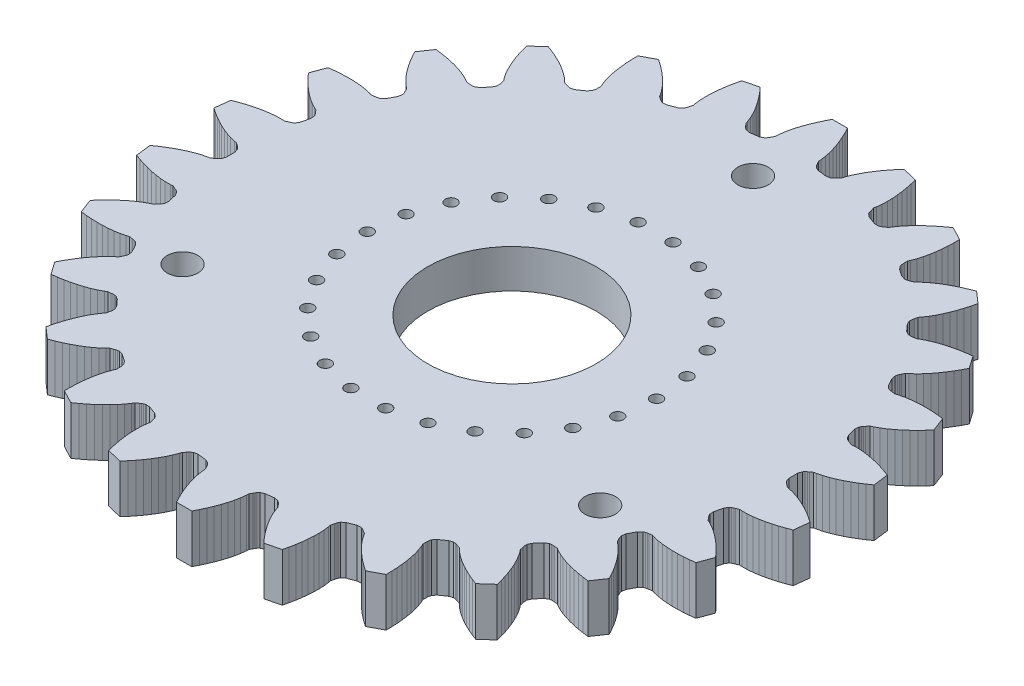
from build123d import *

# Parameters (mm, degrees)
EXTRUDE_RATCHET_EDGE_DEPTH      = 10
PATTERN_EDGE_TO_FORM_GEAR_COUNT = 26
BOSS_EXTRUDE1_DEPTH             = 5
CUT_EXTRUDE1_DEPTH              = 1
SKETCH7_R                       = 8.73125
CUT_BEARING_HOLE_DEPTH          = 51.540175005
CUT_EXTRUDE2_DEPTH              = 1
PIN_HOLES_R                     = 0.6
PIN_HOLES_CUT_DEPTH             = 51.252455557
SKETCH13_R                      = 1.5875
CUT_EXTRUDE3_DEPTH              = 51.252455557
SKETCH14_R                      = 49.986777468
CUT_EXTRUDE4_DEPTH              = 50.288023794


with BuildPart() as part:
    # Sketch1 → Extrude ratchet edge (new body)
    with BuildSketch(Plane(origin=(0, 0, 0), x_dir=(1, 0, 0), z_dir=(0, 1, 0))):
        with BuildLine():
            Line((0, 0), (29.613725431, 7.299127761))
            ThreePointArc((29.613725431, 7.299127761), (31.486736206, 3.871832194), (32, 0))
            Line((32, 0), (0, 0))
        make_face()
    extrude_ratchet_edge = extrude(amount=EXTRUDE_RATCHET_EDGE_DEPTH)

    # Pattern edge to form gear: Extrude ratchet edge ×26 about axis
    pattern_edge_to_form_gear_axis = Axis((0, 10, 0), (0, -1, 0))
    for i in range(1, PATTERN_EDGE_TO_FORM_GEAR_COUNT):
        add(extrude_ratchet_edge.rotate(pattern_edge_to_form_gear_axis, i * 360 / PATTERN_EDGE_TO_FORM_GEAR_COUNT))

    # Sketch12 → Boss-Extrude1 (add)
    with BuildSketch(Plane.XZ):
        Polygon((29.000322753, -0.616570725), (29.119587194, -1.000264746), (29.243967752, -1.150641256), (29.369415025, -1.259655253), (29.495529063, -1.346043346), (29.746268189, -1.535119797), (30.003897471, -1.579567436), (30.516640797, -1.712184271), (31.026553539, -1.886135894), (31.533608527, -2.093643068), (32.037579583, -2.330772238), (32.538146653, -2.595046761), (33.034971107, -2.88478205), (33.527666394, -3.198716608), (34.015860093, -3.535858565), (33.816447683, -5.104204368), (33.259423516, -5.308446667), (32.70383632, -5.489091421), (32.150321721, -5.64527418), (31.599542211, -5.775878742), (31.052267075, -5.879342703), (30.509417131, -5.953364719), (29.972196294, -5.994166602), (29.442574568, -5.994244969), (29.182025762, -5.972811667), (28.891944574, -6.093118219), (28.748223432, -6.14520138), (28.599490608, -6.219357083), (28.441444822, -6.333825435), (28.229944358, -6.675452702), (28.011930996, -7.539016124), (28.035905017, -7.940101093), (28.120680504, -8.11587518), (28.216392404, -8.251742207), (28.318171308, -8.365801825), (28.516371494, -8.609392662), (28.755875004, -8.714201654), (29.221984208, -8.965662), (29.675451563, -9.256588057), (30.118114109, -9.579423324), (30.550688568, -9.930264942), (30.973466667, -10.306654274), (31.38651869, -10.706875291), (31.789774507, -11.129589828), (32.183089813, -11.57376402), (31.614148649, -13.048821615), (31.024422442, -13.113824584), (30.441754669, -13.156257212), (29.866940695, -13.175436936), (29.300913124, -13.170433674), (28.74478387, -13.139917408), (28.199989292, -13.081870202), (27.668616724, -12.992938215), (27.154372567, -12.866268078), (26.906519987, -12.783095695), (26.596074859, -12.830488087), (26.444073202, -12.84666541), (26.281906356, -12.883072461), (26.101055542, -12.956387938), (25.813953244, -13.237478936), (25.395601274, -14.023771373), (25.322903049, -14.418937666), (25.36315151, -14.609882908), (25.423567498, -14.764713169), (25.495086212, -14.899815322), (25.629240235, -15.18375337), (25.836700176, -15.34283377), (26.229084437, -15.698545455), (26.5997556, -16.089541872), (26.952297616, -16.508926), (27.288334305, -16.95309792), (27.60874497, -17.419728423), (27.914013523, -17.907159909), (28.204392535, -18.414097386), (28.479987881, -18.939503891), (27.57456612, -20.235536172), (26.986427049, -20.157520075), (26.410536073, -20.059275238), (25.847829895, -19.940331997), (25.299444988, -19.800019952), (24.766779121, -19.637304534), (24.251710057, -19.450565246), (23.757057144, -19.237040752), (23.288067034, -18.990988592), (23.06732386, -18.850919437), (22.754565163, -18.822639205), (22.603105727, -18.80196765), (22.436947, -18.798508986), (22.243802823, -18.826415616), (21.897766118, -19.030625641), (21.303407339, -19.69395104), (21.138250905, -20.060236642), (21.131629113, -20.255270487), (21.15323291, -20.420055664), (21.190345242, -20.568356596), (21.252649168, -20.876147677), (21.416005351, -21.080258001), (21.711860329, -21.51952615), (21.97818652, -21.987869562), (22.220124958, -22.479441164), (22.440105609, -22.991119504), (22.639534349, -23.520878226), (22.819282941, -24.067199626), (22.979900363, -24.628903355), (23.121744765, -25.204989299), (21.9324827, -26.246678064), (21.380095096, -26.030181096), (20.844455941, -25.796974682), (20.326564429, -25.54682621), (19.827692045, -25.279348604), (19.349446711, -24.993886816), (18.894032469, -24.689313949), (18.464858212, -24.363608827), (18.068377547, -24.012467795), (17.887567892, -23.823651875), (17.590666424, -23.721340283), (17.448544138, -23.665021206), (17.28804749, -23.621901858), (17.093840034, -23.602769671), (16.708985836, -23.718239631), (15.97315002, -24.220048013), (15.725134742, -24.536171365), (15.672029434, -24.723948024), (15.653578582, -24.889120029), (15.65411946, -25.041981213), (15.640952821, -25.355750311), (15.750721025, -25.593020658), (15.932857792, -26.090329901), (16.079363355, -26.608802942), (16.196623032, -27.143979485), (16.287754102, -27.693433061), (16.35461331, -28.255524246), (16.398396125, -28.828988744), (16.419920067, -29.412802364), (16.419780819, -30.00610275), (15.015774768, -30.732908811), (14.531260836, -30.390507062), (14.066985306, -30.035889374), (13.624010391, -29.669070177), (13.203654281, -29.289980387), (12.807615735, -28.898360741), (12.438328878, -28.493653084), (12.099558756, -28.074708794), (11.798647374, -27.638890005), (11.668278983, -27.412282401), (11.404480071, -27.241895059), (11.279977476, -27.153199468), (11.134456303, -27.072915431), (10.9504697, -27.007865397), (10.549167493, -27.027885368), (9.714626697, -27.339008242), (9.398160425, -27.586590109), (9.301665544, -27.756212723), (9.244218621, -27.912162987), (9.208153758, -28.06071406), (9.120282206, -28.362206086), (9.170082238, -28.618851478), (9.2279035, -29.145296822), (9.246079579, -29.683763509), (9.23185423, -30.231458603), (9.188847542, -30.786760421), (9.119242017, -31.348513156), (9.024511085, -31.915788421), (8.905705047, -32.48780017), (8.763586696, -33.063817482), (7.226437894, -33.433502275), (6.837937921, -32.985100273), (6.472031404, -32.529676197), (6.129704286, -32.06750883), (5.812280994, -31.598839186), (5.521481747, -31.123817442), (5.259772592, -30.642494605), (5.031107581, -30.154653437), (4.843234592, -29.659477328), (4.770887712, -29.408259386), (4.555530022, -29.179687086), (4.455867025, -29.06377419), (4.333788034, -28.951008769), (4.170714536, -28.843816474), (3.776294925, -28.76721382), (2.891539758, -28.869578615), (2.52502445, -29.034226188), (2.390731304, -29.175828609), (2.297638331, -29.313489378), (2.227069377, -29.449108533), (2.069602914, -29.720802038), (2.056530545, -29.981914038), (1.986690404, -30.506898661), (1.875468101, -31.03407206), (1.730592111, -31.562438391), (1.555941953, -32.091313679), (1.353929162, -32.620090883), (1.126186865, -33.148213767), (0.873939275, -33.675157544), (0.598102076, -34.200433621), (-0.982851482, -34.19151211), (-1.252752475, -33.663173567), (-1.499045823, -33.133407539), (-1.720812391, -32.602746652), (-1.916852382, -32.071728851), (-2.085523982, -31.540918984), (-2.224440638, -31.01095302), (-2.329708953, -30.482558192), (-2.393621941, -29.956812623), (-2.403747439, -29.695584546), (-2.558141053, -29.42212011), (-2.627173971, -29.285726091), (-2.718708913, -29.147016563), (-2.851390134, -29.003914445), (-3.216023003, -28.835136551), (-4.099572907, -28.722804032), (-4.494838802, -28.794949523), (-4.659110773, -28.900291221), (-4.782449698, -29.011688949), (-4.883410877, -29.126470152), (-5.101335582, -29.352585333), (-5.176514332, -29.602973032), (-5.369956259, -30.096002681), (-5.604102212, -30.581231923), (-5.871223617, -31.059577533), (-6.167361801, -31.531292677), (-6.490054901, -31.996348472), (-6.837566872, -32.454623894), (-7.208597359, -32.905900588), (-7.602119825, -33.349894441), (-9.1349949, -32.962888546), (-9.270609169, -32.385304489), (-9.382967634, -31.811999182), (-9.471292057, -31.243682867), (-9.534557726, -30.68118305), (-9.571304238, -30.125424566), (-9.579345414, -29.577614654), (-9.555100785, -29.039388168), (-9.49133995, -28.513620637), (-9.438659317, -28.257552614), (-9.523124814, -27.95508868), (-9.557507096, -27.806143986), (-9.613188717, -27.649553535), (-9.707771765, -27.4788597), (-10.02141522, -27.227720352), (-10.85239872, -26.907201408), (-11.253452365, -26.882667311), (-11.438160264, -26.945630464), (-11.584575193, -27.024271004), (-11.710068905, -27.111558462), (-11.975772252, -27.27895371), (-12.108692281, -27.504078732), (-12.41450145, -27.936476133), (-12.757967791, -28.351570645), (-13.131798323, -28.752094327), (-13.532226416, -29.139221659), (-13.956837652, -29.513547094), (-14.403925504, -29.875341691), (-14.872162885, -30.224706134), (-15.360509126, -30.561625939), (-16.756226668, -29.819024441), (-16.749676303, -29.225768585), (-16.721567424, -28.642237772), (-16.671323655, -28.069303029), (-16.598129513, -27.508003101), (-16.500806914, -26.959608074), (-16.377516144, -26.425783946), (-16.225174127, -25.908992736), (-16.037444855, -25.413769059), (-15.925002996, -25.177750852), (-15.934633726, -24.863864715), (-15.93237059, -24.711006785), (-15.948957519, -24.54564826), (-15.999945901, -24.357278631), (-16.244380529, -24.038384318), (-16.97450652, -23.528307117), (-17.358032081, -23.408505109), (-17.552442054, -23.425442954), (-17.713420589, -23.466754535), (-17.856162622, -23.521470062), (-18.154202757, -23.620413876), (-18.337128687, -23.807183441), (-18.737535133, -24.153834168), (-19.170366722, -24.474676527), (-19.629185448, -24.774089579), (-20.110618025, -25.054149625), (-20.612472996, -25.315973506), (-21.133151156, -25.560268493), (-21.671390651, -25.787419074), (-22.226177153, -25.997672501), (-23.403626964, -24.942639576), (-23.255288098, -24.368188855), (-23.088349817, -23.80833472), (-22.902449685, -23.264069562), (-22.697053973, -22.736597099), (-22.471322079, -22.227435416), (-22.223855341, -21.738624109), (-21.952265664, -21.27331251), (-21.651477182, -20.837403058), (-21.485824938, -20.635156317), (-21.420055759, -20.328083392), (-21.381271653, -20.180210934), (-21.357809987, -20.015687572), (-21.362236574, -19.82059187), (-21.523243562, -19.452463818), (-22.110092119, -18.782478907), (-22.453804627, -18.574372227), (-22.646613151, -18.544291821), (-22.812807694, -18.545881951), (-22.964493043, -18.564846539), (-23.277546869, -18.589594427), (-23.499862021, -18.727158029), (-23.971598705, -18.967906757), (-24.468627261, -19.175844193), (-24.98576773, -19.356757169), (-25.520238803, -19.513463985), (-26.070163438, -19.647578616), (-26.634174291, -19.760160953), (-27.211133094, -19.851912386), (-27.800124899, -19.92328565), (-28.690864881, -18.617123329), (-28.409361987, -18.094864868), (-28.113294466, -17.591229677), (-27.802546925, -17.107273162), (-27.476891545, -16.644285167), (-27.1358604, -16.203933489), (-26.77861044, -15.788547198), (-26.403559404, -15.401758463), (-26.007179513, -15.050502158), (-25.797945655, -14.893766904), (-25.660597374, -14.611361624), (-25.587555822, -14.477064875), (-25.525397405, -14.322930519), (-25.48300824, -14.132450996), (-25.551244776, -13.736489569), (-25.960701815, -12.945524905), (-26.244620576, -12.661214427), (-26.424630906, -12.585862173), (-26.586363252, -12.547634199), (-26.738187542, -12.529745553), (-27.048075686, -12.4788541), (-27.296840395, -12.559223583), (-27.812481624, -12.680085797), (-28.344830202, -12.763030442), (-28.890241656, -12.814926193), (-29.446685345, -12.839171433), (-30.012733696, -12.837784214), (-30.587294313, -12.81211922), (-31.169446576, -12.763119563), (-31.758393322, -12.691474467), (-32.310669441, -11.210098191), (-31.912366652, -10.770380015), (-31.50437105, -10.352244135), (-31.086839486, -9.956710155), (-30.659842686, -9.585103596), (-30.223339518, -9.239164688), (-29.777060902, -8.921352719), (-29.320342312, -8.635558244), (-28.851424719, -8.389359586), (-28.610758156, -8.287264153), (-28.40981339, -8.045926773), (-28.306761313, -7.933018707), (-28.20952209, -7.798234883), (-28.122771512, -7.623435151), (-28.094268231, -7.222644135), (-28.302534861, -6.35667719), (-28.510162717, -6.012682159), (-28.666910843, -5.896446425), (-28.814801839, -5.820622528), (-28.957928583, -5.766919605), (-29.246631907, -5.643339808), (-29.507410899, -5.661843284), (-30.036983429, -5.655790674), (-30.573721657, -5.608927158), (-31.115698356, -5.528792204), (-31.661774369, -5.419161369), (-32.211037265, -5.282350073), (-32.76276366, -5.119932614), (-33.31627317, -4.933044941), (-33.870961032, -4.722526552), (-34.052673274, -3.152034331), (-33.560714796, -2.820412738), (-33.064502668, -2.512060415), (-32.564446541, -2.227950137), (-32.060931426, -1.969333767), (-31.554319305, -1.737902569), (-31.044951834, -1.536117796), (-30.53311266, -1.367929707), (-30.018904959, -1.24111436), (-29.760795544, -1.19956902), (-29.507935476, -1.013340126), (-29.380858158, -0.928372969), (-29.254185749, -0.820775989), (-29.128129032, -0.671814544), (-29.004538852, -0.289492375), (-28.999514125, 0.601141182), (-29.118778566, 0.984835202), (-29.243159124, 1.135211713), (-29.368606397, 1.24422571), (-29.494720435, 1.330613803), (-29.745459561, 1.519690254), (-30.003078857, 1.564138416), (-30.515832169, 1.696754727), (-31.025744911, 1.870706351), (-31.532799898, 2.078213525), (-32.036770955, 2.315342695), (-32.537338025, 2.579617218), (-33.034162479, 2.869352507), (-33.526857766, 3.183287064), (-34.015051465, 3.520429021), (-33.815639055, 5.088774824), (-33.258614888, 5.293017123), (-32.703027691, 5.473661878), (-32.149513093, 5.629844637), (-31.598733583, 5.760449198), (-31.051458447, 5.86391316), (-30.508608503, 5.937935175), (-29.971378203, 5.978747568), (-29.441765939, 5.978815426), (-29.181217134, 5.957382123), (-28.891135946, 6.077688675), (-28.747414804, 6.129771837), (-28.59868198, 6.203927539), (-28.440636194, 6.318395892), (-28.229136253, 6.660033145), (-28.011122368, 7.52358658), (-28.035096389, 7.92467155), (-28.119871875, 8.100445636), (-28.215583776, 8.236312663), (-28.31736268, 8.350372282), (-28.515562866, 8.593963118), (-28.755066376, 8.69877211), (-29.22117558, 8.950232457), (-29.674643458, 9.2411685), (-30.11730548, 9.56399378), (-30.54987994, 9.914835398), (-30.972658039, 10.291224731), (-31.385710062, 10.691445747), (-31.788965879, 11.114160284), (-32.182281185, 11.558334477), (-31.613340021, 13.033392072), (-31.023613814, 13.098395041), (-30.44094604, 13.140827669), (-29.866132067, 13.160007393), (-29.300104495, 13.15500413), (-28.743975242, 13.124487865), (-28.199181187, 13.066450645), (-27.667808095, 12.977508672), (-27.153563939, 12.850838534), (-26.905711359, 12.767666151), (-26.595266231, 12.815058544), (-26.443264574, 12.831235866), (-26.281097728, 12.867642918), (-26.100246914, 12.940958394), (-25.813144616, 13.222049393), (-25.394792646, 14.00834183), (-25.322094421, 14.403508123), (-25.362342882, 14.594453365), (-25.42275887, 14.749283626), (-25.494277584, 14.884385778), (-25.62843213, 15.168333813), (-25.835891548, 15.327404226), (-26.228275809, 15.683115911), (-26.598946972, 16.074112328), (-26.951488988, 16.493496456), (-27.287525677, 16.937668377), (-27.607936342, 17.404298879), (-27.913204895, 17.891730366), (-28.203583907, 18.398667843), (-28.479179252, 18.924074348), (-27.573757492, 20.220106629), (-26.985618421, 20.142090531), (-26.409727445, 20.043845695), (-25.847021791, 19.92491244), (-25.29863636, 19.784590409), (-24.765970493, 19.621874991), (-24.250901429, 19.435135703), (-23.756248516, 19.221611208), (-23.287258406, 18.975559048), (-23.066515232, 18.835489893), (-22.753757058, 18.807219648), (-22.602297099, 18.786538107), (-22.436138372, 18.783079442), (-22.242994194, 18.810986073), (-21.896958013, 19.015206084), (-21.302598711, 19.678521497), (-21.137442277, 20.044807098), (-21.130821008, 20.23985093), (-21.152424282, 20.40462612), (-21.189536614, 20.552927052), (-21.251830554, 20.860718657), (-21.415196723, 21.064828458), (-21.711052224, 21.504106592), (-21.977377892, 21.972440019), (-22.21931633, 22.464011621), (-22.439296981, 22.975689961), (-22.638725721, 23.505448683), (-22.818474313, 24.051770083), (-22.979091735, 24.613473812), (-23.120936137, 25.189559755), (-21.931674072, 26.231248521), (-21.379286468, 26.014751553), (-20.843647312, 25.781545139), (-20.325755801, 25.531396667), (-19.826883417, 25.263919061), (-19.348638083, 24.978457272), (-18.893223841, 24.673884406), (-18.464049584, 24.348179283), (-18.067568919, 23.997038251), (-17.886759264, 23.808222332), (-17.589857796, 23.70591074), (-17.44773551, 23.649591662), (-17.287238862, 23.606472314), (-17.093031406, 23.587340127), (-16.708177208, 23.702810087), (-15.972341392, 24.204618469), (-15.724326113, 24.520741822), (-15.671220805, 24.70851848), (-15.652769954, 24.873690486), (-15.653310832, 25.026551669), (-15.640144193, 25.340320768), (-15.749912397, 25.577591115), (-15.932049164, 26.074900358), (-16.078554727, 26.593373398), (-16.195814403, 27.128549942), (-16.286945474, 27.678003517), (-16.353804682, 28.240094703), (-16.397587497, 28.813559201), (-16.419111439, 29.397372821), (-16.418972191, 29.990673206), (-15.01496614, 30.717479268), (-14.530452208, 30.375077518), (-14.066176678, 30.020459831), (-13.623201763, 29.653640633), (-13.202845653, 29.274550843), (-12.806807107, 28.882931198), (-12.43752025, 28.478223541), (-12.098750128, 28.059279251), (-11.797838746, 27.623460461), (-11.667470355, 27.396852858), (-11.403671443, 27.226465516), (-11.279158862, 27.137770448), (-11.133647675, 27.057485887), (-10.949661072, 26.992435853), (-10.548358865, 27.012455825), (-9.713818069, 27.323578698), (-9.397351797, 27.571160566), (-9.300856916, 27.74078318), (-9.243409993, 27.896733444), (-9.20734513, 28.045284517), (-9.119473578, 28.346776543), (-9.16927361, 28.603421934), (-9.227094872, 29.129867278), (-9.245270951, 29.668333966), (-9.231045602, 30.21602906), (-9.188038914, 30.771330878), (-9.118433389, 31.333083612), (-9.023702457, 31.900358877), (-8.904896419, 32.472370627), (-8.762778068, 33.048387938), (-7.225629266, 33.418072731), (-6.837129293, 32.969670729), (-6.47121279, 32.514247177), (-6.128895658, 32.052079287), (-5.811472366, 31.583409643), (-5.520673118, 31.108387899), (-5.258963964, 30.627065061), (-5.030298953, 30.139223894), (-4.842425964, 29.644047785), (-4.770079084, 29.392829842), (-4.554721394, 29.164257543), (-4.455058397, 29.048344646), (-4.332979406, 28.935579226), (-4.169905908, 28.82838693), (-3.775486297, 28.751784276), (-2.89073113, 28.854149072), (-2.524215821, 29.018796644), (-2.389922676, 29.160399066), (-2.296830226, 29.298069821), (-2.226260749, 29.43367899), (-2.068794286, 29.705372494), (-2.055721917, 29.966484494), (-1.985881775, 30.491469118), (-1.874659473, 31.018642516), (-1.729783483, 31.547008847), (-1.555133325, 32.075884136), (-1.353120534, 32.604661339), (-1.125378237, 33.132784224), (-0.873130647, 33.659728001), (-0.597293447, 34.185004077), (0.98366011, 34.176082567), (1.253561103, 33.647744024), (1.499854451, 33.117977996), (1.721620496, 32.587327095), (1.91766101, 32.056299308), (2.08633261, 31.525489441), (2.225249266, 30.995523477), (2.330517582, 30.467128648), (2.394430569, 29.941383079), (2.404556067, 29.680155003), (2.558949681, 29.406690567), (2.627982599, 29.270296547), (2.719517541, 29.131587019), (2.852198762, 28.988484902), (3.216841617, 28.819707531), (4.100381535, 28.707374489), (4.49564743, 28.77951998), (4.659919401, 28.884861678), (4.783258326, 28.996259405), (4.884219506, 29.111040609), (5.10214421, 29.337155789), (5.177322436, 29.587553475), (5.370764887, 30.080573137), (5.60491084, 30.565802379), (5.872032245, 31.044147989), (6.168170429, 31.515863134), (6.490863529, 31.980918928), (6.8383755, 32.43919435), (7.209405987, 32.890471045), (7.602928453, 33.334464897), (9.135803529, 32.947459002), (9.271417797, 32.369874946), (9.383776262, 31.796569638), (9.472100685, 31.228253324), (9.535366355, 30.665753507), (9.572112866, 30.109995023), (9.580154042, 29.562185111), (9.555909413, 29.023958624), (9.492148578, 28.498191094), (9.439467946, 28.24212307), (9.523933442, 27.939659137), (9.558315724, 27.790714443), (9.613997345, 27.634123992), (9.708580393, 27.463430156), (10.022223848, 27.212290809), (10.853207348, 26.891771865), (11.254260993, 26.867237767), (11.438968892, 26.930200921), (11.585383821, 27.00884146), (11.710877533, 27.096128918), (11.97658088, 27.263524166), (12.109500909, 27.488649189), (12.415310078, 27.92104659), (12.758776419, 28.336141102), (13.132606951, 28.736664784), (13.533035044, 29.123792116), (13.95764628, 29.498117551), (14.404734132, 29.859912148), (14.872971513, 30.209276591), (15.361317754, 30.546196395), (16.757035296, 29.803594898), (16.750484932, 29.210339042), (16.722376052, 28.626808228), (16.672132283, 28.053873485), (16.598938141, 27.492573558), (16.501615542, 26.94417853), (16.378324773, 26.410354402), (16.225982755, 25.893563193), (16.038253483, 25.398339515), (15.925811624, 25.162321308), (15.935442354, 24.848435171), (15.933179218, 24.695577242), (15.949766147, 24.530218716), (16.000754529, 24.341849088), (16.245189157, 24.022954774), (16.975315148, 23.512877573), (17.358840709, 23.393075566), (17.553250683, 23.41001341), (17.714229217, 23.451324992), (17.85697125, 23.506040519), (18.155011385, 23.604984333), (18.337937315, 23.791753898), (18.738343761, 24.138404625), (19.17117535, 24.459246983), (19.629994076, 24.758660035), (20.111426653, 25.038720082), (20.613281624, 25.300543962), (21.133959784, 25.544838949), (21.67219928, 25.77198953), (22.226985781, 25.982242957), (23.404435592, 24.927210033), (23.256096727, 24.352759312), (23.089158445, 23.792905177), (22.903257789, 23.248650005), (22.697862601, 22.721167555), (22.472130707, 22.212005872), (22.224663969, 21.723194565), (21.953074293, 21.257882966), (21.65228581, 20.821973515), (21.486633566, 20.619726774), (21.420864387, 20.312653848), (21.382080281, 20.164781391), (21.358618615, 20.000258029), (21.363045202, 19.805162326), (21.52405219, 19.437034274), (22.110900747, 18.767049364), (22.454613255, 18.558942684), (22.647421779, 18.528862278), (22.813616322, 18.530452408), (22.965301672, 18.549416996), (23.278365483, 18.574165406), (23.500670649, 18.711728485), (23.972407333, 18.952477213), (24.469435889, 19.160414649), (24.986576358, 19.341327625), (25.521047431, 19.498034441), (26.070972066, 19.632149072), (26.634982919, 19.74473141), (27.211941722, 19.836482843), (27.800933527, 19.907856106), (28.691673509, 18.601693785), (28.410170615, 18.079435325), (28.114103094, 17.575800134), (27.803355553, 17.091843618), (27.477700173, 16.628855624), (27.136669028, 16.188503946), (26.779419068, 15.773117655), (26.404368032, 15.38632892), (26.007988141, 15.035072615), (25.798754283, 14.87833736), (25.661406002, 14.59593208), (25.58836445, 14.461635332), (25.526206033, 14.307500976), (25.483816868, 14.117021453), (25.552053404, 13.721060026), (25.961510443, 12.930095362), (26.245429204, 12.645784884), (26.425439534, 12.570432629), (26.587171881, 12.532204656), (26.73899617, 12.51431601), (27.048884314, 12.463424557), (27.297649023, 12.54379404), (27.813290252, 12.664656254), (28.34563883, 12.747600898), (28.891050284, 12.79949665), (29.447493973, 12.82374189), (30.013542324, 12.82235467), (30.588102941, 12.796689676), (31.170255204, 12.74769002), (31.75920195, 12.676044924), (32.311478069, 11.194668648), (31.91317528, 10.754950472), (31.505179678, 10.336814591), (31.087648114, 9.941280612), (30.660651315, 9.569674052), (30.224148146, 9.223735144), (29.77786953, 8.905923176), (29.32115094, 8.6201287), (28.852233347, 8.373930043), (28.611566784, 8.27183461), (28.410622018, 8.030497229), (28.307569941, 7.917589163), (28.210330718, 7.782805339), (28.123580141, 7.608005608), (28.095076859, 7.207214591), (28.303343489, 6.341247647), (28.510971345, 5.997252616), (28.667719471, 5.881016882), (28.815610467, 5.805192985), (28.958737211, 5.751490062), (29.247440535, 5.627910264), (29.508219527, 5.646413741), (30.037792057, 5.640361131), (30.574530285, 5.593497614), (31.116506984, 5.513362661), (31.662582997, 5.403731826), (32.211845893, 5.26692053), (32.763572288, 5.104503071), (33.317081798, 4.917615397), (33.87176966, 4.707097009), (34.053481903, 3.136604788), (33.561523424, 2.804983194), (33.065311296, 2.496630872), (32.565255169, 2.212520593), (32.061740055, 1.953904223), (31.555127933, 1.722473025), (31.045760462, 1.520688252), (30.533921289, 1.352500164), (30.019713587, 1.225684816), (29.761604172, 1.184139477), (29.508744104, 0.997910583), (29.381666786, 0.912943425), (29.254994377, 0.805346446), (29.12893766, 0.656385001), (29.00534748, 0.274062831), align=None)
    extrude(amount=BOSS_EXTRUDE1_DEPTH)

    # Sketch10 → Cut-Extrude1 (cut)
    with BuildSketch(Plane(origin=(0, 10, 0), x_dir=(1, 0, 0), z_dir=(0, 1, 0))):
        with BuildLine():
            Line((-0.753755436, 29.351723584), (-0.753755436, 27.351723584))
            ThreePointArc((-0.753755436, 27.351723584), (0.246244564, -27.630088583), (1.246244564, 27.351723584))
            Line((1.246244564, 27.351723584), (1.246244564, 29.351723584))
            Line((1.246244564, 29.351723584), (-0.753755436, 29.351723584))
        make_face()
    extrude(amount=-CUT_EXTRUDE1_DEPTH, mode=Mode.SUBTRACT)

    # Sketch7 → Cut bearing hole (cut, through all)
    with BuildSketch(Plane(origin=(0, 10, 0), x_dir=(1, 0, 0), z_dir=(0, 1, 0))):
        Circle(SKETCH7_R)
    extrude(amount=-CUT_BEARING_HOLE_DEPTH, mode=Mode.SUBTRACT)

    # Sketch11 → Cut-Extrude2 (cut)
    with BuildSketch(Plane.XZ.offset(5)):
        with BuildLine():
            Line((1, -29.481812167), (1, -27.481812167))
            ThreePointArc((1, -27.481812167), (0, 27.5), (-1, -27.481812167))
            Line((-1, -27.481812167), (-1, -29.481812167))
            Line((-1, -29.481812167), (1, -29.481812167))
        make_face()
    extrude(amount=-CUT_EXTRUDE2_DEPTH, mode=Mode.SUBTRACT)

    # pin holes → Pin holes cut (cut, through all)
    with BuildSketch(Plane(origin=(0, 9, 0), x_dir=(1, 0, 0), z_dir=(0, 1, 0))):
        with Locations((15, 0)):
            Circle(PIN_HOLES_R)
        with Locations((14.564127261, -3.589734964)):
            Circle(PIN_HOLES_R)
        with Locations((13.281840385, -6.970847581)):
            Circle(PIN_HOLES_R)
        with Locations((11.227661223, -9.946839874)):
            Circle(PIN_HOLES_R)
        with Locations((8.520971201, -12.344757988)):
            Circle(PIN_HOLES_R)
        with Locations((5.319073306, -14.02524364)):
            Circle(PIN_HOLES_R)
        with Locations((1.808050204, -14.890633111)):
            Circle(PIN_HOLES_R)
        with Locations((-1.808050204, -14.890633111)):
            Circle(PIN_HOLES_R)
        with Locations((-5.319073306, -14.02524364)):
            Circle(PIN_HOLES_R)
        with Locations((-8.520971201, -12.344757988)):
            Circle(PIN_HOLES_R)
        with Locations((-11.227661223, -9.946839874)):
            Circle(PIN_HOLES_R)
        with Locations((-13.281840385, -6.970847581)):
            Circle(PIN_HOLES_R)
        with Locations((-14.564127261, -3.589734964)):
            Circle(PIN_HOLES_R)
        with Locations((-15, 0)):
            Circle(PIN_HOLES_R)
        with Locations((-14.564127261, 3.589734964)):
            Circle(PIN_HOLES_R)
        with Locations((-13.281840385, 6.970847581)):
            Circle(PIN_HOLES_R)
        with Locations((-11.227661223, 9.946839874)):
            Circle(PIN_HOLES_R)
        with Locations((-8.520971201, 12.344757988)):
            Circle(PIN_HOLES_R)
        with Locations((-5.319073306, 14.02524364)):
            Circle(PIN_HOLES_R)
        with Locations((-1.808050204, 14.890633111)):
            Circle(PIN_HOLES_R)
        with Locations((1.808050204, 14.890633111)):
            Circle(PIN_HOLES_R)
        with Locations((5.319073306, 14.02524364)):
            Circle(PIN_HOLES_R)
        with Locations((8.520971201, 12.344757988)):
            Circle(PIN_HOLES_R)
        with Locations((11.227661223, 9.946839874)):
            Circle(PIN_HOLES_R)
        with Locations((13.281840385, 6.970847581)):
            Circle(PIN_HOLES_R)
        with Locations((14.564127261, 3.589734964)):
            Circle(PIN_HOLES_R)
    extrude(amount=-PIN_HOLES_CUT_DEPTH, mode=Mode.SUBTRACT)

    # Sketch13 → Cut-Extrude3 (cut, through all)
    with BuildSketch(Plane.XZ.offset(4)):
        with Locations((0, -25)):
            Circle(SKETCH13_R)
        with Locations((-21.650635095, 12.5)):
            Circle(SKETCH13_R)
        with Locations((21.650635095, 12.5)):
            Circle(SKETCH13_R)
    extrude(amount=-CUT_EXTRUDE3_DEPTH, mode=Mode.SUBTRACT)

    # Sketch14 → Cut-Extrude4 (cut, through all)
    with BuildSketch(Plane.XZ):
        Circle(SKETCH14_R)
    extrude(amount=-CUT_EXTRUDE4_DEPTH, mode=Mode.SUBTRACT)


solid = part.part
